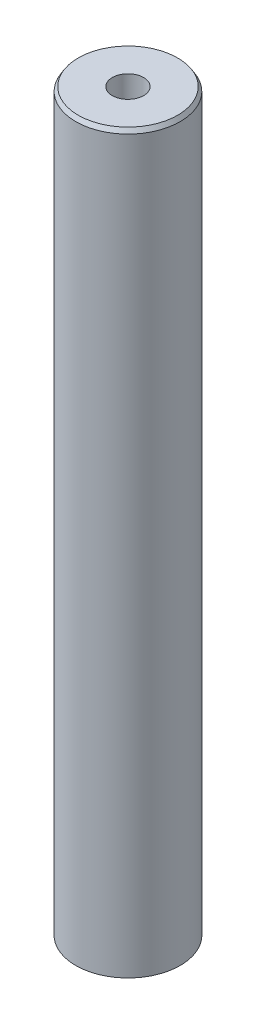
from build123d import *
from OCP.BRepFilletAPI import BRepFilletAPI_MakeChamfer

# Parameters (mm, degrees)
SKETCH1_R           = 42.5
BOSS_EXTRUDE1_DEPTH = 600
SKETCH2_R           = 12.758098986
CUT_EXTRUDE1_DEPTH  = 604.002902149
CHAMFER1_SIZE       = 3.456162817
CHAMFER1_SIZE2      = 2.082288479


with BuildPart() as part:
    # Sketch1 → Boss-Extrude1 (new body)
    with BuildSketch(Plane(origin=(0, 0, 0), x_dir=(1, 0, 0), z_dir=(0, 1, 0))):
        Circle(SKETCH1_R)
    extrude(amount=BOSS_EXTRUDE1_DEPTH)

    # Sketch2 → Cut-Extrude1 (cut, through all)
    with BuildSketch(Plane(origin=(0, 0, 0), x_dir=(1, 0, 0), z_dir=(0, 1, 0))):
        Circle(SKETCH2_R)
    extrude(amount=CUT_EXTRUDE1_DEPTH, mode=Mode.SUBTRACT)

    # Chamfer1: one chamfer whose edges measure the first distance from different faces: ONE call of the kernel's chamfer builder (chamfer() names one face for all edges)
    chamfer1_edges_1 = [part.edges().sort_by_distance(p)[0] for p in [
        (-42.5, 600, 0),
    ]]
    chamfer1_side_1 = [part.faces().sort_by_distance(p)[0] for p in [
        (-42.5, 300, 0),
    ]]
    chamfer1_edges_2 = [part.edges().sort_by_distance(p)[0] for p in [
        (-42.5, 0, 0),
    ]]
    chamfer1_side_2 = [part.faces().sort_by_distance(p)[0] for p in [
        (-41.297918472, 0, 0),
    ]]
    chamfer1 = BRepFilletAPI_MakeChamfer(part.part.solid().wrapped)
    for e in chamfer1_edges_1:
        chamfer1.Add(CHAMFER1_SIZE, CHAMFER1_SIZE2, e.wrapped, chamfer1_side_1[0].wrapped)  # the first distance lies on this face
    for e in chamfer1_edges_2:
        chamfer1.Add(CHAMFER1_SIZE, CHAMFER1_SIZE2, e.wrapped, chamfer1_side_2[0].wrapped)  # the first distance lies on this face
    add(Compound.cast(chamfer1.Shape()), mode=Mode.REPLACE)


solid = part.part
